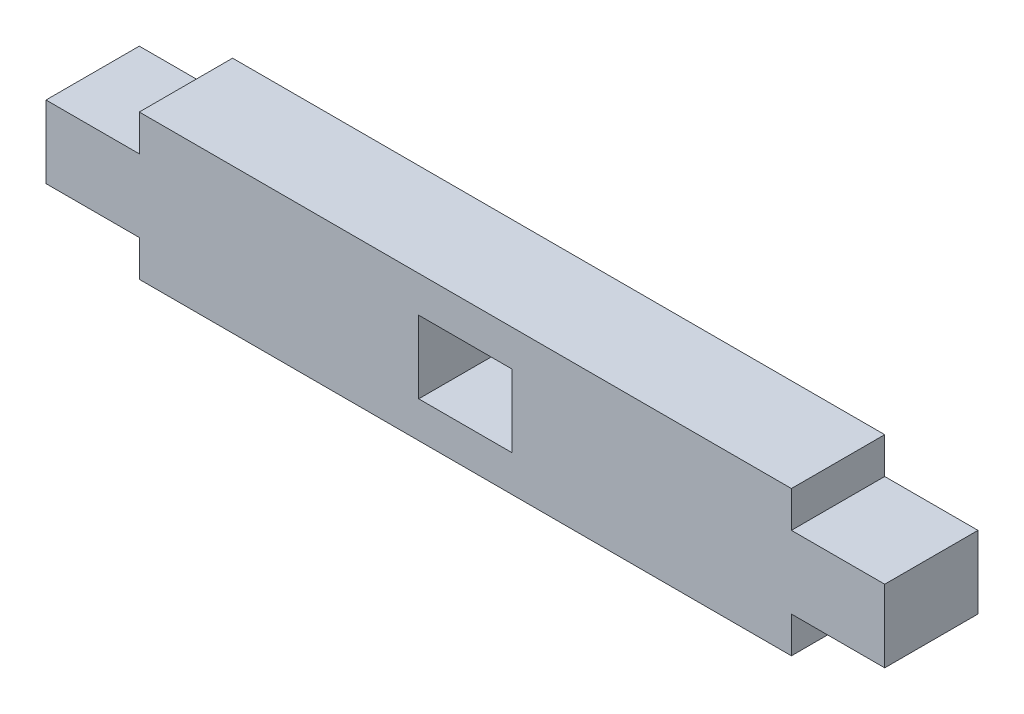
from build123d import *

# Parameters (mm, degrees)
BOSS_EXTRUDE1_DEPTH = 5.15
SKETCH3_W           = 5.15
SKETCH3_H           = 4
CUT_EXTRUDE1_DEPTH  = 26.028883315


with BuildPart() as part:
    # Sketch1 → Boss-Extrude1 (new body)
    with BuildSketch(Plane.XY):
        Polygon((-18, 8), (18, 8), (18, 6), (23.15, 6), (23.15, 2), (18, 2), (18, 0), (-18, 0), (-18, 2), (-23.15, 2), (-23.15, 6), (-18, 6), align=None)
    extrude(amount=BOSS_EXTRUDE1_DEPTH)

    # Sketch3 → Cut-Extrude1 (cut, through all)
    with BuildSketch(Plane.XY.offset(5.15)):
        with Locations((0, 4)):
            Rectangle(SKETCH3_W, SKETCH3_H)
    extrude(amount=-CUT_EXTRUDE1_DEPTH, mode=Mode.SUBTRACT)


solid = part.part
